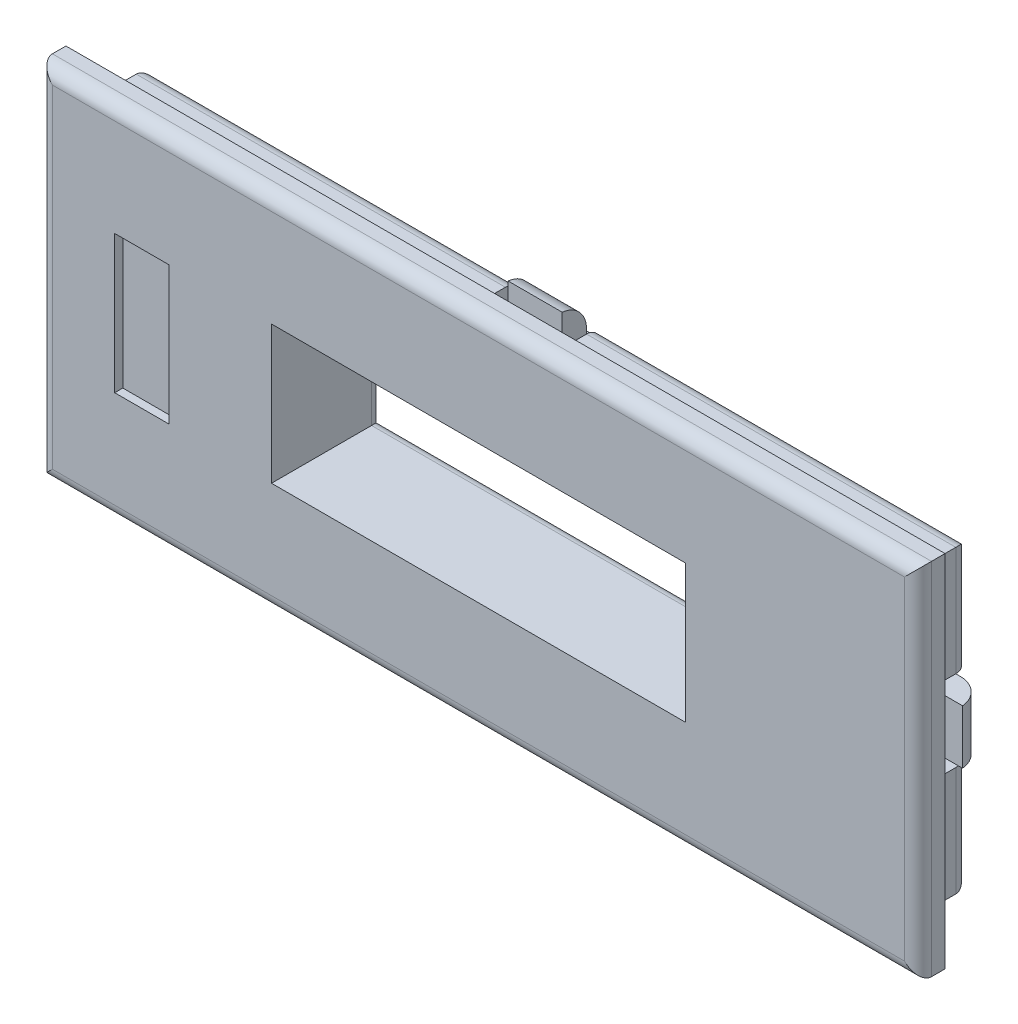
from build123d import *

# Parameters (mm, degrees)
SZKIC1_W                    = 30.3
SZKIC1_H                    = 11.1
SZKIC1_W_2                  = 28.304453741
SZKIC1_H_2                  = 9.1
DODANIE_WYCI_GNI_CIE1_DEPTH = 2
SZKIC2_W                    = 32.5
SZKIC2_H                    = 13.3
DODANIE_WYCI_GNI_CIE2_DEPTH = 1
ZAOKR_GLENIE1_R             = 0.5
SZKIC3_W                    = 1.095546259
SZKIC3_H                    = 0.5
SZKIC3_W_2                  = 1.2
SZKIC3_W_3                  = 0.5
SZKIC3_H_2                  = 1.2
SZKIC3_H_3                  = 1.1
WYTNIJ_WYCI_GNI_CIE1_DEPTH  = 1.4
ZAOKR_GLENIE2_R             = 0.5
SZKIC4_W                    = 2
SZKIC4_H                    = 1.15
SZKIC4_W_2                  = 1.145546259
SZKIC4_H_2                  = 2
SZKIC4_W_3                  = 1.15
DODANIE_WYCI_GNI_CIE3_DEPTH = 0.9
SZKIC5_W                    = 0.9
SZKIC5_H                    = 2
DODANIE_WYCI_GNI_CIE4_DEPTH = 0.5
SZKIC6_W                    = 2
SZKIC6_H                    = 0.9
DODANIE_WYCI_GNI_CIE5_DEPTH = 0.5
SZKIC7_W                    = 0.9
SZKIC7_H                    = 2
DODANIE_WYCI_GNI_CIE6_DEPTH = 0.5
ZAOKR_GLENIE5_R             = 1
SZKIC8_W                    = 28.304453741
SZKIC8_H                    = 9.1
DODANIE_WYCI_GNI_CIE7_DEPTH = 0.6
SZKIC9_W                    = 15.3
SZKIC9_H                    = 5.1
WYTNIJ_WYCI_GNI_CIE2_DEPTH  = 1.6
SZKIC10_W                   = 15.3
SZKIC10_H                   = 5.1
DODANIE_WYCI_GNI_CIE8_DEPTH = 2.5
ZAOKR_GLENIE6_R             = 0.4
SZKIC11_W                   = 2
SZKIC11_H                   = 5.1
WYTNIJ_WYCI_GNI_CIE3_DEPTH  = 0.3


with BuildPart() as part:
    # Szkic1 → Dodanie-wyciągnięcie1 (new body)
    with BuildSketch(Plane.XY):
        with Locations((-1.679789747, 1.465189223)):
            Rectangle(SZKIC1_W, SZKIC1_H)
        with Locations((-1.682016617, 1.465189223)):
            Rectangle(SZKIC1_W_2, SZKIC1_H_2, mode=Mode.SUBTRACT)
    extrude(amount=DODANIE_WYCI_GNI_CIE1_DEPTH)

    # Szkic2 → Dodanie-wyciągnięcie2 (add)
    with BuildSketch(Plane.XY.offset(2)):
        with Locations((-1.679789747, 1.465189223)):
            Rectangle(SZKIC2_W, SZKIC2_H)
    extrude(amount=DODANIE_WYCI_GNI_CIE2_DEPTH)

    # Zaokrąglenie1
    zaokr_glenie1_edges = [part.edges().sort_by_distance(p)[0] for p in [
        (-17.929789747, 1.465189223, 3),
        (-1.679789747, -5.184810777, 3),
        (14.570210253, 1.465189223, 3),
        (-1.679789747, 8.115189223, 3),
    ]]
    fillet(zaokr_glenie1_edges, radius=ZAOKR_GLENIE1_R)

    # Szkic3 → Wytnij-wyciągnięcie1 (cut)
    with BuildSketch(Plane(origin=(0, 0, 0), x_dir=(-1, 0, 0), z_dir=(0, 0, -1))):
        with Locations((16.382016617, 2.715189223)):
            Rectangle(SZKIC3_W, SZKIC3_H)
        with Locations((-13.070210253, 0.215189223)):
            Rectangle(SZKIC3_W_2, SZKIC3_H)
        with Locations((2.932016617, 6.615189223)):
            Rectangle(SZKIC3_W_3, SZKIC3_H_2)
        with Locations((0.432016617, 6.615189223)):
            Rectangle(SZKIC3_W_3, SZKIC3_H_2)
        with Locations((-13.070210253, 2.715189223)):
            Rectangle(SZKIC3_W_2, SZKIC3_H)
        with Locations((2.932016617, -3.634810777)):
            Rectangle(SZKIC3_W_3, SZKIC3_H_3)
        with Locations((0.432016617, -3.634810777)):
            Rectangle(SZKIC3_W_3, SZKIC3_H_3)
        with Locations((16.382016617, 0.215189223)):
            Rectangle(SZKIC3_W, SZKIC3_H)
    extrude(amount=-WYTNIJ_WYCI_GNI_CIE1_DEPTH, mode=Mode.SUBTRACT)

    # Zaokrąglenie2
    zaokr_glenie2_edges = [part.edges().sort_by_distance(p)[0] for p in [
        (6.644096818, 7.015189223, 0),
        (13.470210253, -2.059810777, 0),
        (-10.005903182, -4.084810777, 0),
        (-16.829789747, 4.990189223, 0),
        (-10.005903182, 7.015189223, 0),
        (13.470210253, 4.990189223, 0),
        (6.644096818, -4.084810777, 0),
        (-16.829789747, -2.059810777, 0),
    ]]
    fillet(zaokr_glenie2_edges, radius=ZAOKR_GLENIE2_R)

    # Szkic4 → Dodanie-wyciągnięcie3 (add)
    with BuildSketch(Plane(origin=(0, 0, 0), x_dir=(-1, 0, 0), z_dir=(0, 0, -1))):
        Polygon((0.682016617, 6.015189223), (2.682016617, 6.015189223), (2.682016617, 7.165189223), (2.682016617, 7.665189223), (0.682016617, 7.665189223), (0.682016617, 7.165189223), align=None)
        with Locations((1.682016617, -3.659810777)):
            Rectangle(SZKIC4_W, SZKIC4_H)
        with Locations((16.407016618, 1.465189223)):
            Rectangle(SZKIC4_W_2, SZKIC4_H_2)
        with Locations((-13.045210253, 1.465189223)):
            Rectangle(SZKIC4_W_3, SZKIC4_H_2)
    extrude(amount=-DODANIE_WYCI_GNI_CIE3_DEPTH)

    # Szkic5 → Dodanie-wyciągnięcie4 (add)
    with BuildSketch(Plane(origin=(13.620210253, 0, 0), x_dir=(0, 0, -1), z_dir=(1, 0, 0))):
        with Locations((-0.45, 1.465189223)):
            Rectangle(SZKIC5_W, SZKIC5_H)
    extrude(amount=DODANIE_WYCI_GNI_CIE4_DEPTH)

    # Szkic6 → Dodanie-wyciągnięcie5 (add)
    with BuildSketch(Plane.XZ.offset(4.234810777)):
        with Locations((-1.682016617, 0.45)):
            Rectangle(SZKIC6_W, SZKIC6_H)
    extrude(amount=DODANIE_WYCI_GNI_CIE5_DEPTH)

    # Szkic7 → Dodanie-wyciągnięcie6 (add)
    with BuildSketch(Plane.ZY.offset(16.979789747)):
        with Locations((0.45, 1.465189223)):
            Rectangle(SZKIC7_W, SZKIC7_H)
    extrude(amount=DODANIE_WYCI_GNI_CIE6_DEPTH)

    # Zaokrąglenie5
    # the kernel refuses this fillet: 1 mm, written as the material it takes off along each edge
    with BuildSketch(Plane(origin=(-5.16948521, 7.665189223, 0), x_dir=(0, -1, 0), z_dir=(1, 0, 0))) as zaokr_glenie5_piece_1:
        with BuildLine():
            CenterArc((0.994987437, -1), ZAOKR_GLENIE5_R, 90, 84.260829523)
            Line((0, -0.9), (-0.019899749, -0.898))
            ThreePointArc((-0.019899749, -0.898), (-0.02, -0.45), (-0.02, 0))
            Line((-0.02, 0), (0, 0.02))
            Line((0, 0.02), (0.994987437, 0.02))
            Line((0.994987437, 0.02), (0.994987437, 0))
        make_face()
    extrude(amount=6.974937186, mode=Mode.SUBTRACT)
    with BuildSketch(Plane(origin=(14.120210253, 4.952657816, 0), x_dir=(0, 0, 1), z_dir=(0, -1, 0)), Plane(origin=(1.805451975, -4.734810777, 0), x_dir=(0, 0, 1), z_dir=(-1, 0, 0)), Plane(origin=(-17.479789747, -2.02227937, 0), x_dir=(0, 0, 1), z_dir=(0, 1, 0))) as zaokr_glenie5_piece_2:
        with BuildLine():
            CenterArc((1, 0.994987437), ZAOKR_GLENIE5_R, 180, 84.260829523)
            Line((0, 0.994987437), (-0.02, 0.994987437))
            Line((-0.02, 0.994987437), (-0.02, 0))
            Line((-0.02, 0), (0, -0.02))
            ThreePointArc((0, -0.02), (0.45, -0.02), (0.898, -0.019899749))
            Line((0.898, -0.019899749), (0.9, 0))
        make_face()
    extrude(amount=6.974937186, mode=Mode.SUBTRACT)

    # Szkic8 → Dodanie-wyciągnięcie7 (add)
    with BuildSketch(Plane(origin=(0, 0, 2), x_dir=(-1, 0, 0), z_dir=(0, 0, -1))):
        with Locations((1.682016617, 1.465189223)):
            Rectangle(SZKIC8_W, SZKIC8_H)
    extrude(amount=DODANIE_WYCI_GNI_CIE7_DEPTH)

    # Szkic9 → Wytnij-wyciągnięcie2 (cut)
    with BuildSketch(Plane.XY.offset(3)):
        with Locations((-1.679789747, 1.465189223)):
            Rectangle(SZKIC9_W, SZKIC9_H)
    extrude(amount=-WYTNIJ_WYCI_GNI_CIE2_DEPTH, mode=Mode.SUBTRACT)

    # Szkic10 → Dodanie-wyciągnięcie8 (add)
    with BuildSketch(Plane(origin=(0, 0, 1.4), x_dir=(-1, 0, 0), z_dir=(0, 0, -1))):
        Polygon((-7.470210253, 5.515189223), (10.829789747, 5.515189223), (10.829789747, -2.584810777), (9.329789747, -2.584810777), (-5.970210253, -2.584810777), (-7.470210253, -2.584810777), align=None)
        with Locations((1.679789747, 1.465189223)):
            Rectangle(SZKIC10_W, SZKIC10_H, mode=Mode.SUBTRACT)
    extrude(amount=DODANIE_WYCI_GNI_CIE8_DEPTH)

    # Zaokrąglenie6
    zaokr_glenie6_edges = [part.edges().sort_by_distance(p)[0] for p in [
        (5.970210253, 1.465189223, -1.1),
        (-1.679789747, -1.084810777, -1.1),
        (-9.329789747, 1.465189223, -1.1),
        (-1.679789747, 4.015189223, -1.1),
    ]]
    fillet(zaokr_glenie6_edges, radius=ZAOKR_GLENIE6_R)

    # Szkic11 → Wytnij-wyciągnięcie3 (cut)
    with BuildSketch(Plane.XY.offset(3)):
        with Locations((-14.12705039, 1.465189223)):
            Rectangle(SZKIC11_W, SZKIC11_H)
    extrude(amount=-WYTNIJ_WYCI_GNI_CIE3_DEPTH, mode=Mode.SUBTRACT)


solid = part.part
